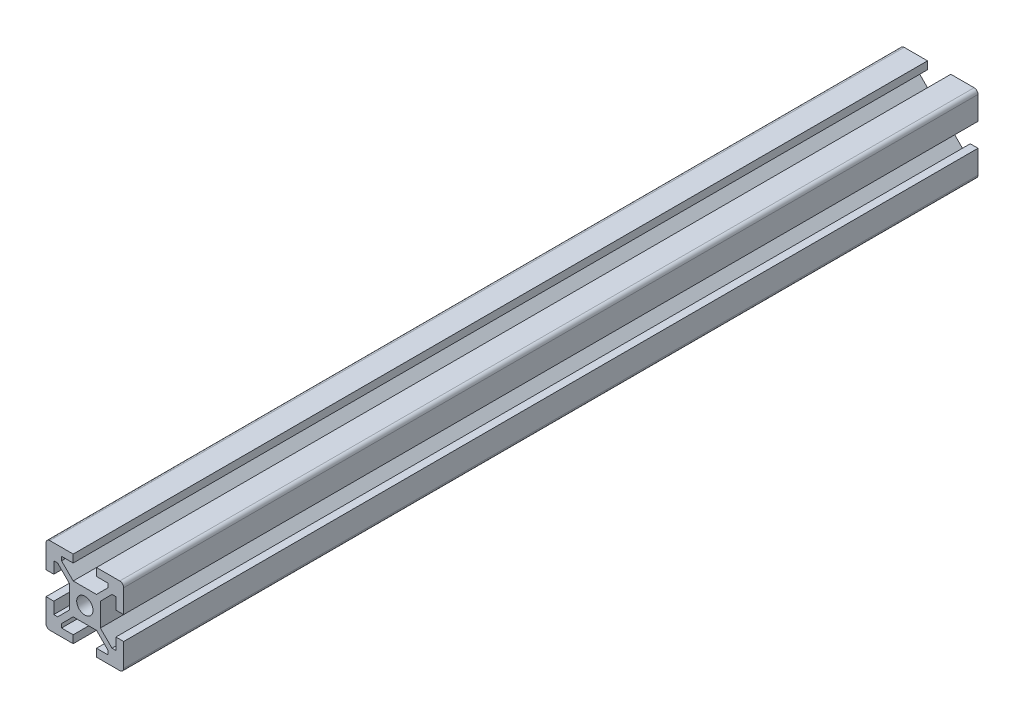
from build123d import *

# Parameters (mm, degrees)
SKETCH1_R           = 2.1
BOSS_EXTRUDE1_DEPTH = 220


with BuildPart() as part:
    # Sketch1 → Boss-Extrude1 (new body)
    with BuildSketch(Plane(origin=(0, 0, 0), x_dir=(-1, 0, 0), z_dir=(0, 0, -1))):
        with BuildLine():
            Line((6, -8), (3, -8))
            Line((3, -8), (3, -10))
            Line((3, -10), (9, -10))
            ThreePointArc((9, -10), (9.707106781, -9.707106781), (10, -9))
            Line((10, -9), (10, -3))
            Line((10, -3), (8, -3))
            Line((8, -3), (8, -6))
            Line((8, -6), (7, -6))
            Line((7, -6), (4, -3))
            Line((4, -3), (4, 3))
            Line((4, 3), (7, 6))
            Line((7, 6), (8, 6))
            Line((8, 6), (8, 3))
            Line((8, 3), (10, 3))
            Line((10, 3), (10, 9))
            ThreePointArc((10, 9), (9.707106781, 9.707106781), (9, 10))
            Line((9, 10), (3, 10))
            Line((3, 10), (3, 8))
            Line((3, 8), (6, 8))
            Line((6, 8), (6, 7))
            Line((6, 7), (3, 4))
            Line((3, 4), (-3, 4))
            Line((-3, 4), (-6, 7))
            Line((-6, 7), (-6, 8))
            Line((-6, 8), (-3, 8))
            Line((-3, 8), (-3, 10))
            Line((-3, 10), (-9, 10))
            ThreePointArc((-9, 10), (-9.707106781, 9.707106781), (-10, 9))
            Line((-10, 9), (-10, 3))
            Line((-10, 3), (-8, 3))
            Line((-8, 3), (-8, 6))
            Line((-8, 6), (-7, 6))
            Line((-7, 6), (-4, 3))
            Line((-4, 3), (-4, -3))
            Line((-4, -3), (-7, -6))
            Line((-7, -6), (-8, -6))
            Line((-8, -6), (-8, -3))
            Line((-8, -3), (-10, -3))
            Line((-10, -3), (-10, -9))
            ThreePointArc((-10, -9), (-9.707106781, -9.707106781), (-9, -10))
            Line((-9, -10), (-3, -10))
            Line((-3, -10), (-3, -8))
            Line((-3, -8), (-6, -8))
            Line((-6, -8), (-6, -7))
            Line((-6, -7), (-3, -4))
            Line((-3, -4), (3, -4))
            Line((3, -4), (6, -7))
            Line((6, -7), (6, -8))
        make_face()
        Circle(SKETCH1_R, mode=Mode.SUBTRACT)
    extrude(amount=-BOSS_EXTRUDE1_DEPTH)


solid = part.part
